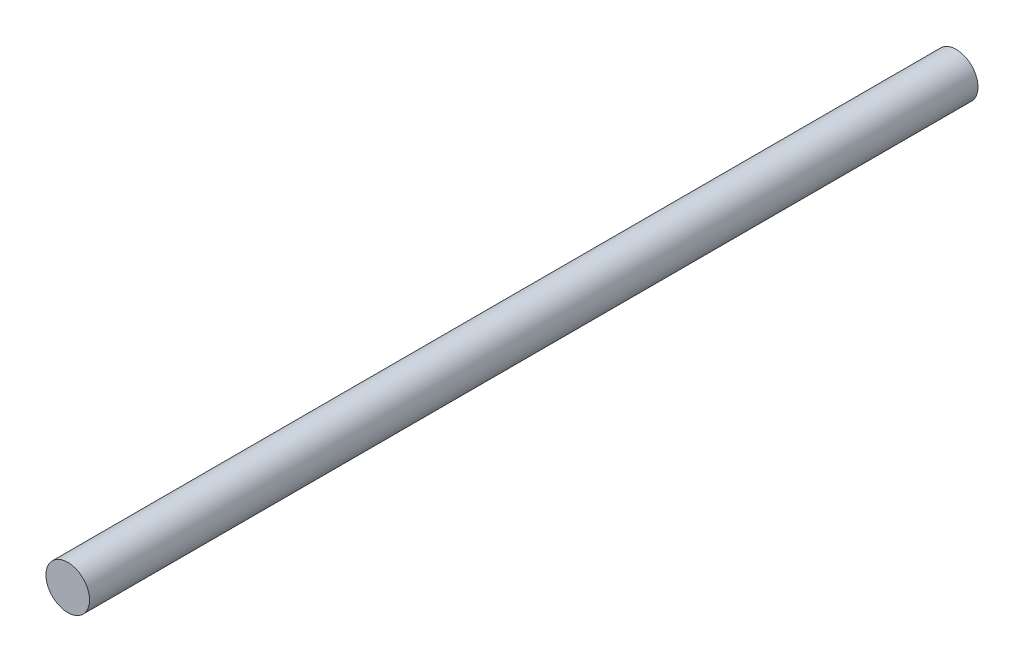
from build123d import *

# Parameters (mm, degrees)
SKETCH1_R           = 2.4892
BOSS_EXTRUDE1_DEPTH = 101.473


with BuildPart() as part:
    # Sketch1 → Boss-Extrude1 (new body)
    with BuildSketch(Plane.XY):
        Circle(SKETCH1_R)
    extrude(amount=BOSS_EXTRUDE1_DEPTH)


solid = part.part
